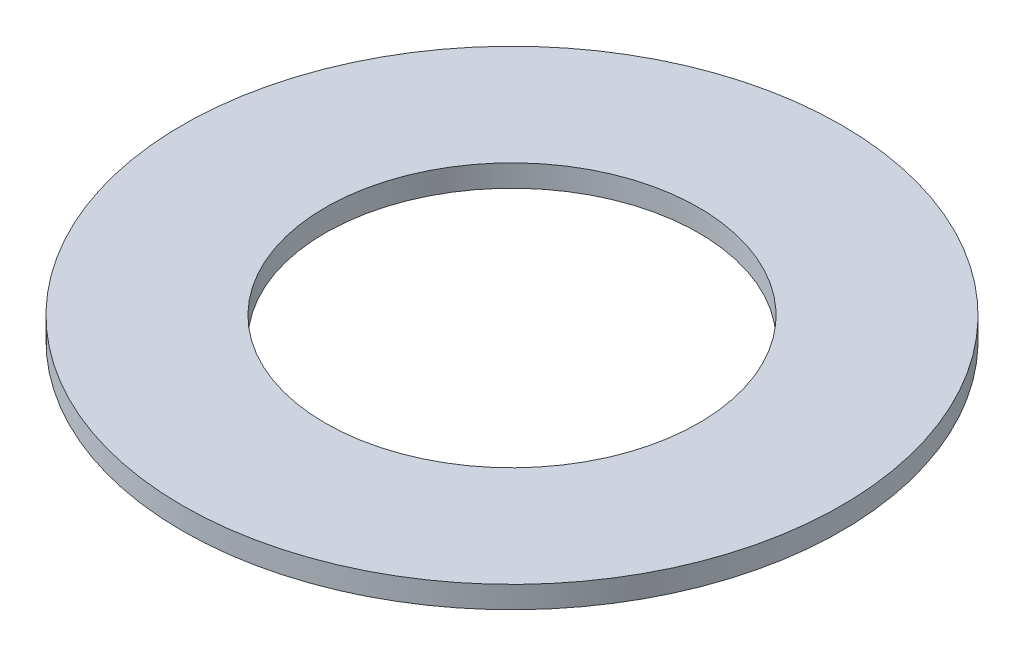
from build123d import *

# Parameters (mm, degrees)
SKETCH1_R           = 75
BOSS_EXTRUDE1_DEPTH = 5
SKETCH2_R           = 42.5
CUT_EXTRUDE1_DEPTH  = 107.183802908


with BuildPart() as part:
    # Sketch1 → Boss-Extrude1 (new body)
    with BuildSketch(Plane(origin=(0, 0, 0), x_dir=(1, 0, 0), z_dir=(0, 1, 0))):
        Circle(SKETCH1_R)
    extrude(amount=BOSS_EXTRUDE1_DEPTH)

    # Sketch2 → Cut-Extrude1 (cut, through all)
    with BuildSketch(Plane(origin=(0, 0, 0), x_dir=(1, 0, 0), z_dir=(0, 1, 0))):
        Circle(SKETCH2_R)
    extrude(amount=CUT_EXTRUDE1_DEPTH, mode=Mode.SUBTRACT)


solid = part.part
